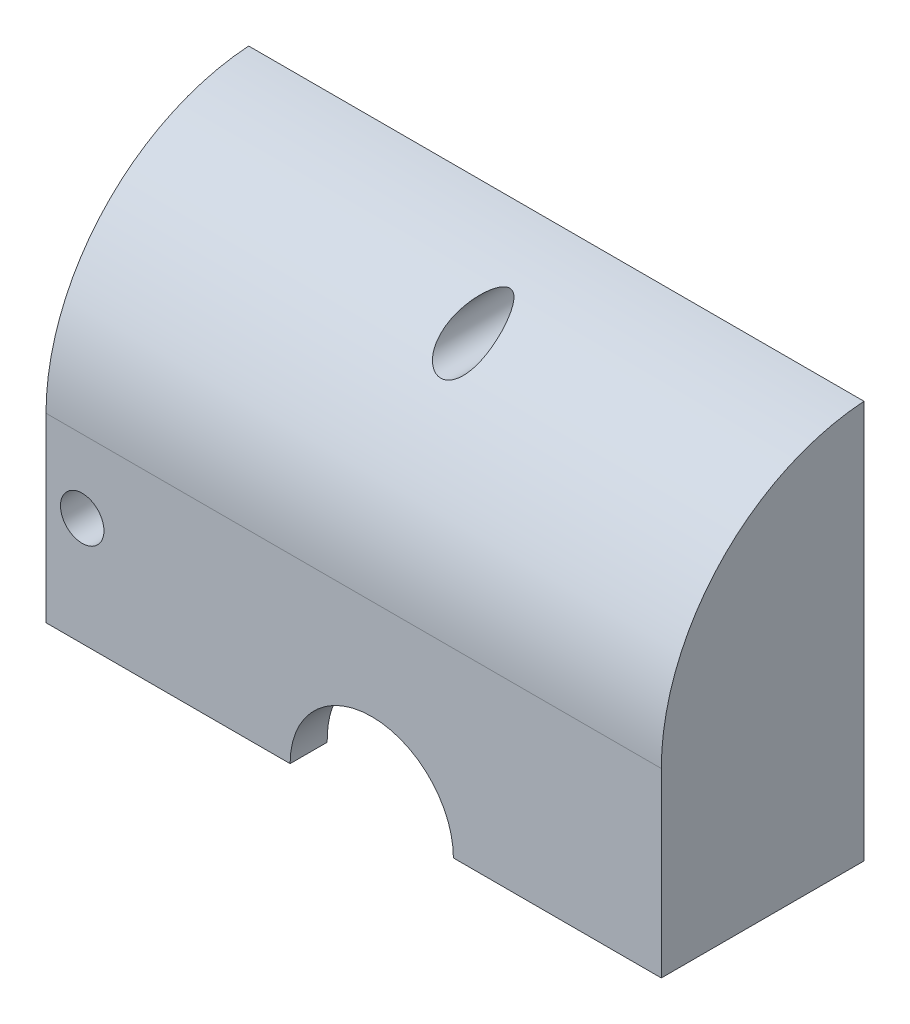
from build123d import *

# Parameters (mm, degrees)
SKETCH1_W           = 90
SKETCH1_H           = 110
BOSS_EXTRUDE1_DEPTH = 28
FILLET2_R           = 30
SKETCH3_R           = 1.5
CUT_EXTRUDE1_DEPTH  = 145.858551698
SKETCH4_R           = 3
CUT_EXTRUDE4_DEPTH  = 26
CUT_EXTRUDE5_START  = -13.7
SKETCH5_W           = 73
SKETCH5_H           = 87
CUT_EXTRUDE5_DEPTH  = 13.7
CUT_EXTRUDE5_TAPER  = 15
SKETCH8_W           = 73
SKETCH8_H           = 87
CUT_EXTRUDE8_DEPTH  = 11.8
CUT_EXTRUDE8_DRAFT  = -70
CUT_EXTRUDE9_START  = 30
SKETCH9_R           = 11.28
CUT_EXTRUDE9_DEPTH  = 61.8
FILLET19_R          = 20
SKETCH13_W          = 90
SKETCH13_H          = 55
CUT_EXTRUDE10_DEPTH = 145.858551855
CUT_EXTRUDE12_REACH = 146.859
SKETCH15_W          = 5
SKETCH15_H          = 55
CUT_EXTRUDE13_DEPTH = 145.858551855


with BuildPart() as part:
    # Sketch1 → Boss-Extrude1 (new body)
    with BuildSketch(Plane.XY):
        with Locations((45, 55)):
            Rectangle(SKETCH1_W, SKETCH1_H)
    extrude(amount=BOSS_EXTRUDE1_DEPTH)

    # Fillet2
    # the kernel refuses this fillet: 30 mm, written as the material it takes off along each edge
    with BuildSketch(Plane(origin=(-74.833147735, 0, 28), x_dir=(0, 0, -1), z_dir=(1, 0, 0)), Plane(origin=(164.833147735, 110, 28), x_dir=(0, 0, -1), z_dir=(-1, 0, 0))) as fillet2_piece_1:
        with BuildLine():
            CenterArc((30, 29.933259094), FILLET2_R, 180, 86.177446271)
            Line((0, 29.933259094), (-0.6, 29.933259094))
            Line((-0.6, 29.933259094), (-0.6, 0))
            Line((-0.6, 0), (0, -0.6))
            ThreePointArc((0, -0.6), (14, -0.6), (27.96, -0.598665182))
            Line((27.96, -0.598665182), (28, 0))
        make_face()
    extrude(amount=239.666295471, mode=Mode.SUBTRACT)

    # Sketch3 → Cut-Extrude1 (cut, through all)
    with BuildSketch(Plane(origin=(0, 0, 0), x_dir=(-1, 0, 0), z_dir=(0, 0, -1))):
        with Locations((-45, 105)):
            Circle(SKETCH3_R)
        with Locations((-45, 5)):
            Circle(SKETCH3_R)
        with Locations((-5, 70)):
            Circle(SKETCH3_R)
        with Locations((-5, 40)):
            Circle(SKETCH3_R)
    extrude(amount=-CUT_EXTRUDE1_DEPTH, mode=Mode.SUBTRACT)

    # Sketch4 → Cut-Extrude4 (cut)
    with BuildSketch(Plane.XY.offset(28)):
        with Locations((45, 105)):
            Circle(SKETCH4_R)
        with Locations((45, 5)):
            Circle(SKETCH4_R)
        with Locations((5, 70)):
            Circle(SKETCH4_R)
        with Locations((5, 40)):
            Circle(SKETCH4_R)
    extrude(amount=-CUT_EXTRUDE4_DEPTH, mode=Mode.SUBTRACT)

    # Sketch5 → Cut-Extrude5 (cut)
    with BuildSketch(Plane(origin=(0, 0, 0), x_dir=(-1, 0, 0), z_dir=(0, 0, -1)).offset(CUT_EXTRUDE5_START)):
        with Locations((-45, 55)):
            Rectangle(SKETCH5_W, SKETCH5_H)
    extrude(amount=CUT_EXTRUDE5_DEPTH, taper=CUT_EXTRUDE5_TAPER, mode=Mode.SUBTRACT)


with BuildPart() as cut_extrude8_tool:
    # Sketch8 → Cut-Extrude8 (with draft: the straight prism first)
    with BuildSketch(Plane(origin=(0, 0, 13.7), x_dir=(-1, 0, 0), z_dir=(0, 0, -1))):
        with Locations((-45, 55)):
            Rectangle(SKETCH8_W, SKETCH8_H)
    extrude(amount=-CUT_EXTRUDE8_DEPTH)
    # Cut-Extrude8: the draft: its side faces are tilted about the plane it starts from
    cut_extrude8_sides = [cut_extrude8_tool.faces().sort_by_distance(p)[0] for p in [
        (81.5, 55, 19.6),
        (45, 11.5, 19.6),
        (8.5, 55, 19.6),
        (45, 98.5, 19.6),
    ]]
    draft(cut_extrude8_sides, Plane(origin=(0, 0, 13.7), x_dir=(-1, 0, 0), z_dir=(0, 0, -1)), CUT_EXTRUDE8_DRAFT)


with BuildPart() as part_1:
    add(part.part)

    # Cut-Extrude8: cut by cut_extrude8_tool
    add(cut_extrude8_tool.part, mode=Mode.SUBTRACT)

    # Sketch9 → Cut-Extrude9 (cut)
    with BuildSketch(Plane(origin=(0, 0, 25.5), x_dir=(-1, 0, 0), z_dir=(0, 0, -1)).offset(CUT_EXTRUDE9_START)):
        with Locations((-45.00023355, 55.00023355)):
            Circle(SKETCH9_R)
    extrude(amount=-CUT_EXTRUDE9_DEPTH, mode=Mode.SUBTRACT)

    # Fillet19
    fillet19_edges = [part_1.edges().sort_by_distance(p)[0] for p in [
        (79.664548032, 96.664548032, 6.85),
        (79.664548032, 13.335451968, 6.85),
        (10.335451968, 13.335451968, 6.85),
        (10.335451968, 96.664548032, 6.85),
    ]]
    fillet(fillet19_edges, radius=FILLET19_R)

    # Sketch13 → Cut-Extrude10 (cut, through all)
    with BuildSketch(Plane(origin=(0, 0, 0), x_dir=(-1, 0, 0), z_dir=(0, 0, -1))):
        with Locations((-45, 27.5)):
            Rectangle(SKETCH13_W, SKETCH13_H)
    extrude(amount=-CUT_EXTRUDE10_DEPTH, mode=Mode.SUBTRACT)

    # Cut-Extrude12: up to this plane
    cut_extrude12_end = Plane(origin=(8.5, 11.5, 13.7), z_dir=(-0.9659258262890681, 0, -0.25881904510252135))
    # Sketch14 → Cut-Extrude12 (cut, up to the surface)
    with BuildSketch(Plane.ZY, mode=Mode.PRIVATE) as cut_extrude12_sk1:
        with BuildLine():
            Line((6.5, 58.5), (0, 58.5))
            Line((0, 58.5), (0, 51.5))
            Line((0, 51.5), (6.5, 51.5))
            ThreePointArc((6.5, 51.5), (10, 55), (6.5, 58.5))
        make_face()
    cut_extrude12_tool1 = split(extrude(cut_extrude12_sk1.sketch, amount=-CUT_EXTRUDE12_REACH, mode=Mode.PRIVATE), bisect_by=cut_extrude12_end, keep=Keep.BOTH, mode=Mode.PRIVATE)
    add(cut_extrude12_tool1.solids().sort_by_distance((0, 55, 4.657437))[0], mode=Mode.SUBTRACT)

    # Sketch15 → Cut-Extrude13 (cut, through all)
    with BuildSketch(Plane(origin=(0, 0, 0), x_dir=(-1, 0, 0), z_dir=(0, 0, -1))):
        with Locations((-87.5, 82.5)):
            Rectangle(SKETCH15_W, SKETCH15_H)
    extrude(amount=-CUT_EXTRUDE13_DEPTH, mode=Mode.SUBTRACT)


solid = part_1.part
